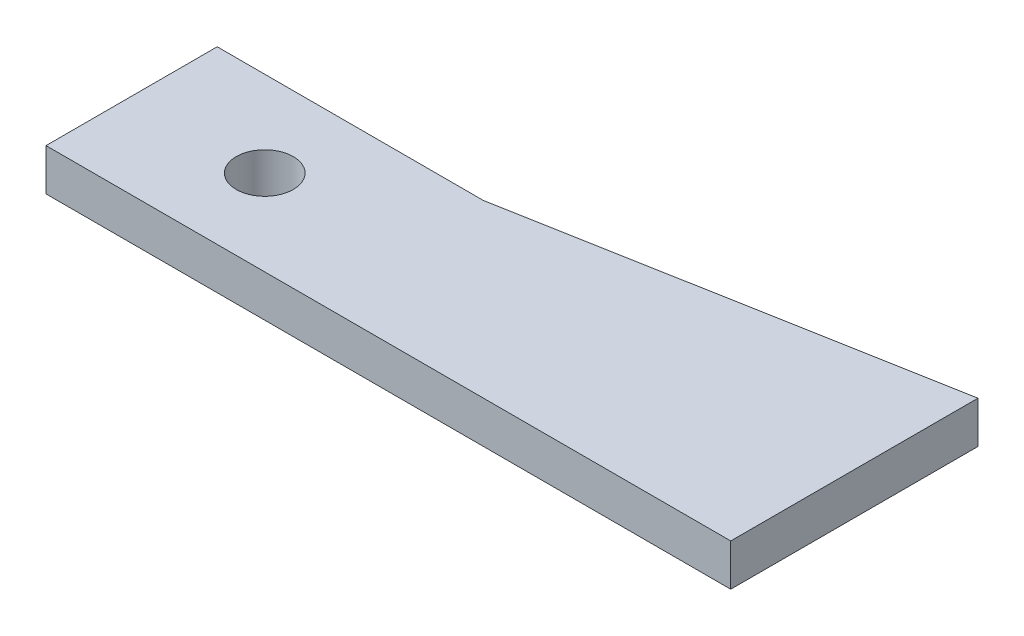
from build123d import *

# Parameters (mm, degrees)
BOSS_EXTRUDE1_DEPTH = 13.97
SKETCH3_R           = 9.525
CUT_EXTRUDE1_DEPTH  = 13.97


with BuildPart() as part:
    # Sketch1 → Boss-Extrude1 (new body)
    with BuildSketch(Plane(origin=(0, 0, 0), x_dir=(1, 0, 0), z_dir=(0, 1, 0))):
        Polygon((-44.45, -28.575), (184.15, -28.575), (184.15, 53.975), (44.45, 28.575), (-44.45, 28.575), align=None)
    extrude(amount=BOSS_EXTRUDE1_DEPTH)

    # Sketch3 → Cut-Extrude1 (cut)
    with BuildSketch(Plane(origin=(0, 13.97, 0), x_dir=(1, 0, 0), z_dir=(0, 1, 0))):
        Circle(SKETCH3_R)
    extrude(amount=-CUT_EXTRUDE1_DEPTH, mode=Mode.SUBTRACT)


solid = part.part
